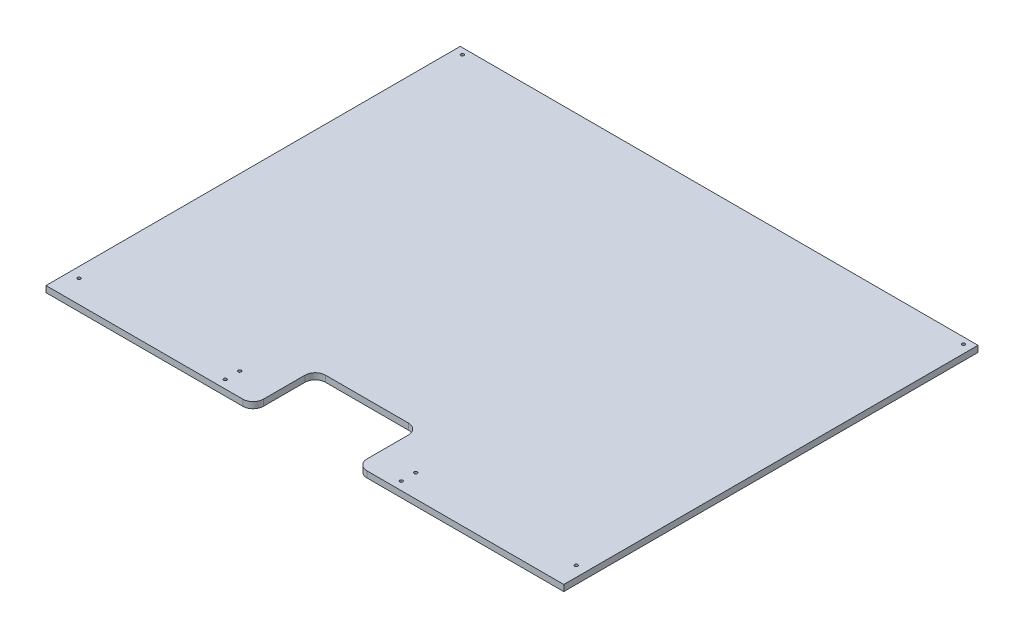
from build123d import *

# Parameters (mm, degrees)
SKETCH1_W           = 500
SKETCH1_H           = 400
SKETCH1_R           = 1.5
SKETCH1_R_2         = 1.525
BOSS_EXTRUDE1_DEPTH = 6
SKETCH2_R           = 1.5
CUT_EXTRUDE1_DEPTH  = 10
SKETCH3_W           = 100
SKETCH3_H           = 60
CUT_EXTRUDE2_DEPTH  = 641.340534403
FILLET1_R           = 10


with BuildPart() as part:
    # Sketch1 → Boss-Extrude1 (new body)
    with BuildSketch(Plane(origin=(0, 0, 0), x_dir=(1, 0, 0), z_dir=(0, 1, 0))):
        with Locations((250, -200)):
            Rectangle(SKETCH1_W, SKETCH1_H)
        with Locations((490, -378)):
            Circle(SKETCH1_R, mode=Mode.SUBTRACT)
        with Locations((10, -378)):
            Circle(SKETCH1_R, mode=Mode.SUBTRACT)
        with Locations((8, -6)):
            Circle(SKETCH1_R, mode=Mode.SUBTRACT)
        with Locations((492, -6)):
            Circle(SKETCH1_R_2, mode=Mode.SUBTRACT)
    extrude(amount=BOSS_EXTRUDE1_DEPTH)

    # Sketch2 → Cut-Extrude1 (cut)
    with BuildSketch(Plane(origin=(0, 6, 0), x_dir=(1, 0, 0), z_dir=(0, 1, 0))):
        with Locations((165, -378)):
            Circle(SKETCH2_R)
        with Locations((165, -392)):
            Circle(SKETCH2_R)
        with Locations((335, -378)):
            Circle(SKETCH2_R)
        with Locations((335, -392)):
            Circle(SKETCH2_R)
    extrude(amount=-CUT_EXTRUDE1_DEPTH, mode=Mode.SUBTRACT)

    # Sketch3 → Cut-Extrude2 (cut, through all)
    with BuildSketch(Plane.XZ):
        with Locations((250, 370)):
            Rectangle(SKETCH3_W, SKETCH3_H)
    extrude(amount=-CUT_EXTRUDE2_DEPTH, mode=Mode.SUBTRACT)

    # Fillet1
    fillet1_edges = [part.edges().sort_by_distance(p)[0] for p in [
        (200, 3, 400),
        (300, 3, 400),
        (200, 3, 340),
        (300, 3, 340),
    ]]
    fillet(fillet1_edges, radius=FILLET1_R)


solid = part.part
